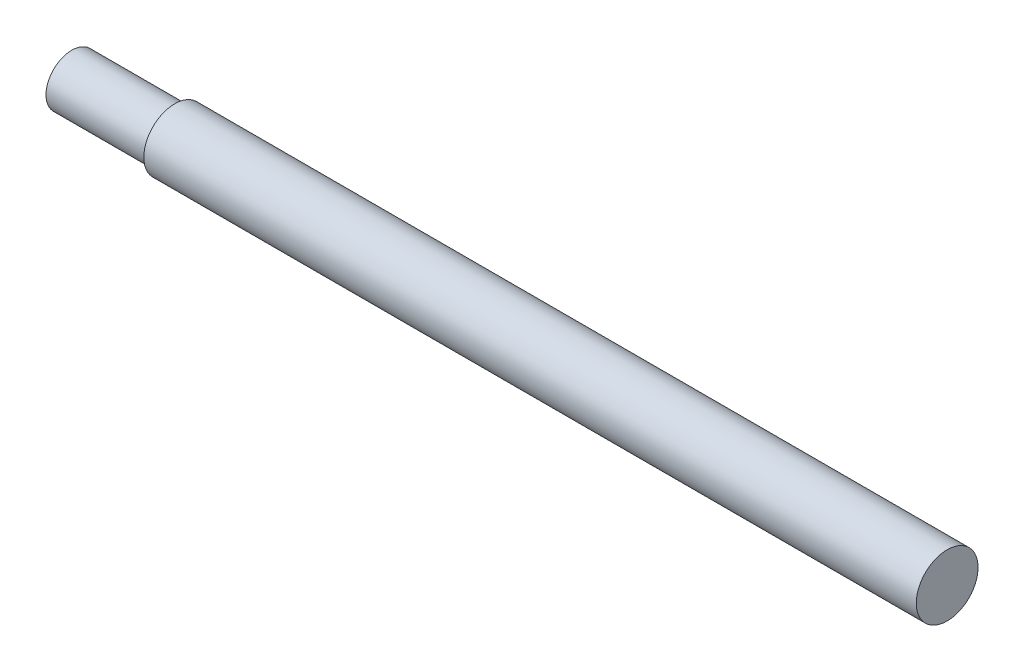
from build123d import *


with BuildPart() as part:
    # Esquisse1 → Révolution1 (revolve)
    with BuildSketch(Plane.XY):
        Polygon((-75.830261752, 0), (-75.830261752, 5), (-55.830261752, 5), (-55.830261752, 6), (94.169738248, 6), (94.169738248, 0), align=None)
    revolve(axis=Axis((-81.606850381, 0, 0), (1, 0, 0)))


solid = part.part
